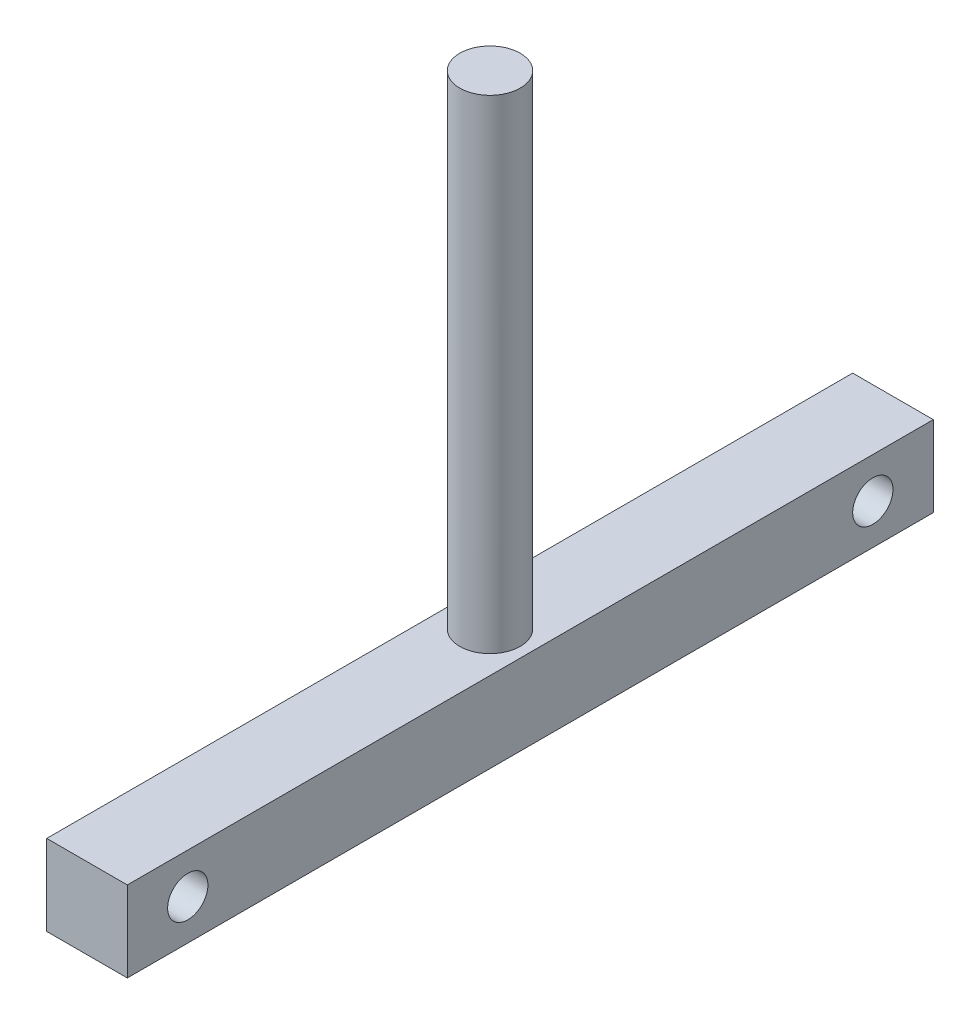
from build123d import *

# Parameters (mm, degrees)
SKETCH1_W           = 20
SKETCH1_H           = 20
BOSS_EXTRUDE1_DEPTH = 200
SKETCH2_R           = 7.5
BOSS_EXTRUDE2_DEPTH = 120
SKETCH3_R           = 5
CUT_EXTRUDE1_DEPTH  = 57


with BuildPart() as part:
    # Sketch1 → Boss-Extrude1 (new body)
    with BuildSketch(Plane.XY):
        Rectangle(SKETCH1_W, SKETCH1_H)
    extrude(amount=BOSS_EXTRUDE1_DEPTH)

    # Sketch2 → Boss-Extrude2 (add)
    with BuildSketch(Plane(origin=(0, 10, 0), x_dir=(1, 0, 0), z_dir=(0, 1, 0))):
        with Locations((0, -100)):
            Circle(SKETCH2_R)
    extrude(amount=BOSS_EXTRUDE2_DEPTH)

    # Sketch3 → Cut-Extrude1 (cut)
    with BuildSketch(Plane.ZY.offset(10)):
        with Locations((15, 0)):
            Circle(SKETCH3_R)
        with Locations((185, 0)):
            Circle(SKETCH3_R)
    extrude(amount=-CUT_EXTRUDE1_DEPTH, mode=Mode.SUBTRACT)


solid = part.part
